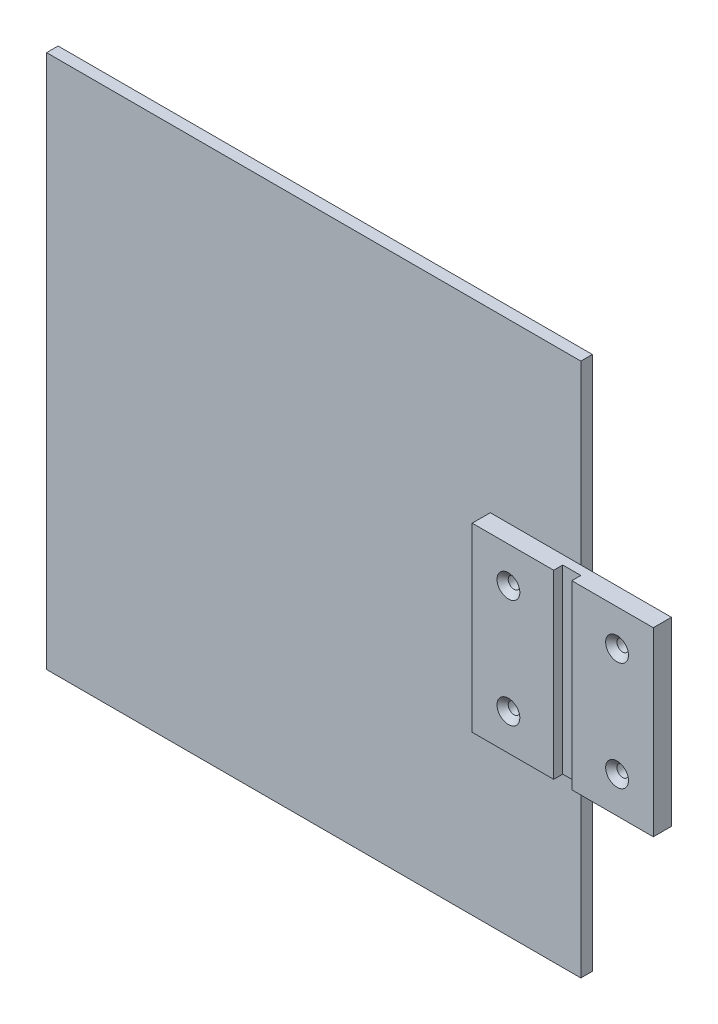
from build123d import *

# Parameters (mm, degrees)
SKETCH1_W           = 295
SKETCH1_H           = 295
BOSS_EXTRUDE1_DEPTH = 6.35
SKETCH2_W           = 100
SKETCH2_H           = 100
BOSS_EXTRUDE2_DEPTH = 10
SKETCH6_W           = 10
SKETCH6_H           = 100
CUT_EXTRUDE1_DEPTH  = 5


# Read off the part's stored shape, not the designer's step: CSK for M6 Flat Head Machine Screw1
with BuildPart() as part:
    # Sketch1 → Boss-Extrude1 (new body)
    with BuildSketch(Plane.XY):
        with Locations((147.5, 147.5)):
            Rectangle(SKETCH1_W, SKETCH1_H)
    extrude(amount=BOSS_EXTRUDE1_DEPTH)

    # Sketch2 → Boss-Extrude2 (add)
    with BuildSketch(Plane.XY.offset(6.35)):
        with Locations((295, 147.5)):
            Rectangle(SKETCH2_W, SKETCH2_H)
    extrude(amount=BOSS_EXTRUDE2_DEPTH)

    # CSK for M6 Flat Head Machine Screw1 outl → CSK for M6 Flat Head Machine Screw1 (revolve, cut)
    with BuildSketch(Plane(origin=(325, 177.5, 0), x_dir=(1, 0, 0), z_dir=(0, -1, 0))):
        Polygon((0, 6.35), (3.2, 6.35), (3.2, 13.25), (6.3, 16.35), (0, 16.35), align=None)
    revolve(axis=Axis((325, 177.5, 0), (0, 0, 1)), mode=Mode.SUBTRACT)

    # CSK for M6 Flat Head Machine Screw1 2 ou → CSK for M6 Flat Head Machine Screw1 2 (revolve, cut)
    with BuildSketch(Plane(origin=(265, 117.5, 0), x_dir=(1, 0, 0), z_dir=(0, -1, 0))):
        Polygon((0, 16.35), (0, 4.427246019), (3.2, 6.35), (3.2, 13.25), (6.3, 16.35), align=None)
    revolve(axis=Axis((265, 117.5, 0), (0, 0, 1)), mode=Mode.SUBTRACT)

    # CSK for M6 Flat Head Machine Screw1 3 ou → CSK for M6 Flat Head Machine Screw1 3 (revolve, cut)
    with BuildSketch(Plane(origin=(325, 117.5, 0), x_dir=(1, 0, 0), z_dir=(0, -1, 0))):
        Polygon((0, 6.35), (3.2, 6.35), (3.2, 13.25), (6.3, 16.35), (0, 16.35), align=None)
    revolve(axis=Axis((325, 117.5, 0), (0, 0, 1)), mode=Mode.SUBTRACT)

    # CSK for M6 Flat Head Machine Screw1 4 ou → CSK for M6 Flat Head Machine Screw1 4 (revolve, cut)
    with BuildSketch(Plane(origin=(265, 177.5, 0), x_dir=(1, 0, 0), z_dir=(0, -1, 0))):
        Polygon((0, 16.35), (0, 4.427246019), (3.2, 6.35), (3.2, 13.25), (6.3, 16.35), align=None)
    revolve(axis=Axis((265, 177.5, 0), (0, 0, 1)), mode=Mode.SUBTRACT)

    # Sketch6 → Cut-Extrude1 (cut)
    with BuildSketch(Plane.XY.offset(16.35)):
        with Locations((295, 147.5)):
            Rectangle(SKETCH6_W, SKETCH6_H)
    extrude(amount=-CUT_EXTRUDE1_DEPTH, mode=Mode.SUBTRACT)


solid = part.part
